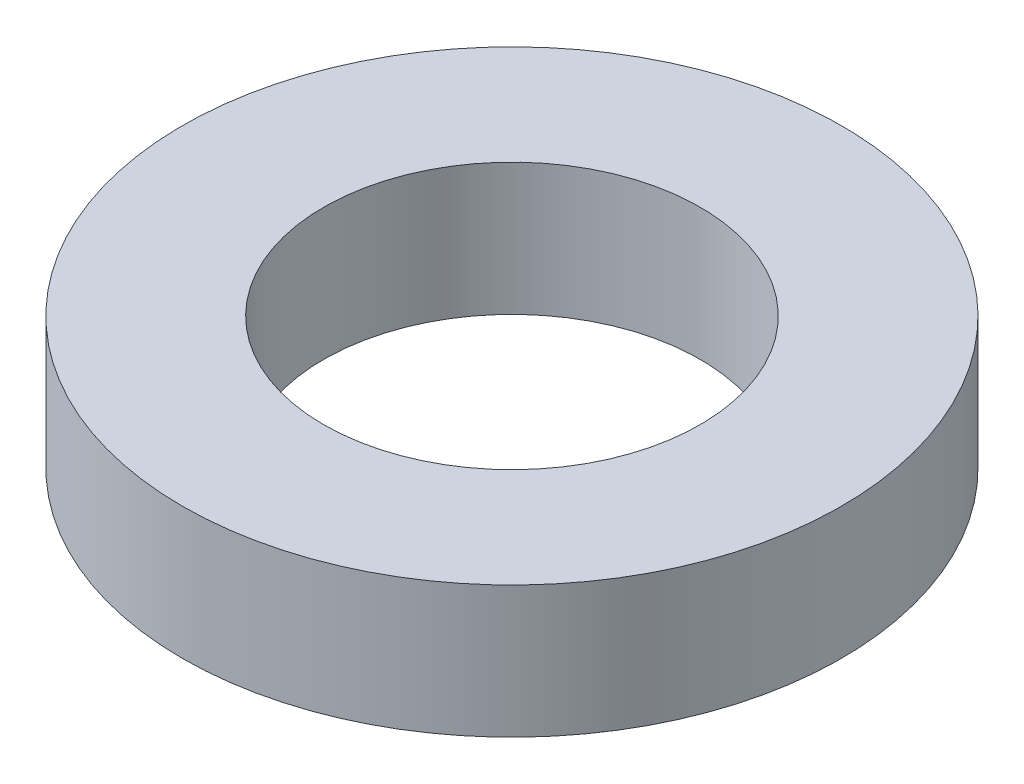
from build123d import *

# Parameters (mm, degrees)
SKETCH1_R           = 35
BOSS_EXTRUDE1_DEPTH = 14
SKETCH2_R           = 20
CUT_EXTRUDE1_DEPTH  = 52.439284598


with BuildPart() as part:
    # Sketch1 → Boss-Extrude1 (new body)
    with BuildSketch(Plane(origin=(0, 0, 0), x_dir=(1, 0, 0), z_dir=(0, 1, 0))):
        Circle(SKETCH1_R)
    extrude(amount=BOSS_EXTRUDE1_DEPTH)

    # Sketch2 → Cut-Extrude1 (cut, through all)
    with BuildSketch(Plane(origin=(0, 0, 0), x_dir=(1, 0, 0), z_dir=(0, 1, 0))):
        Circle(SKETCH2_R)
    extrude(amount=CUT_EXTRUDE1_DEPTH, mode=Mode.SUBTRACT)


solid = part.part
